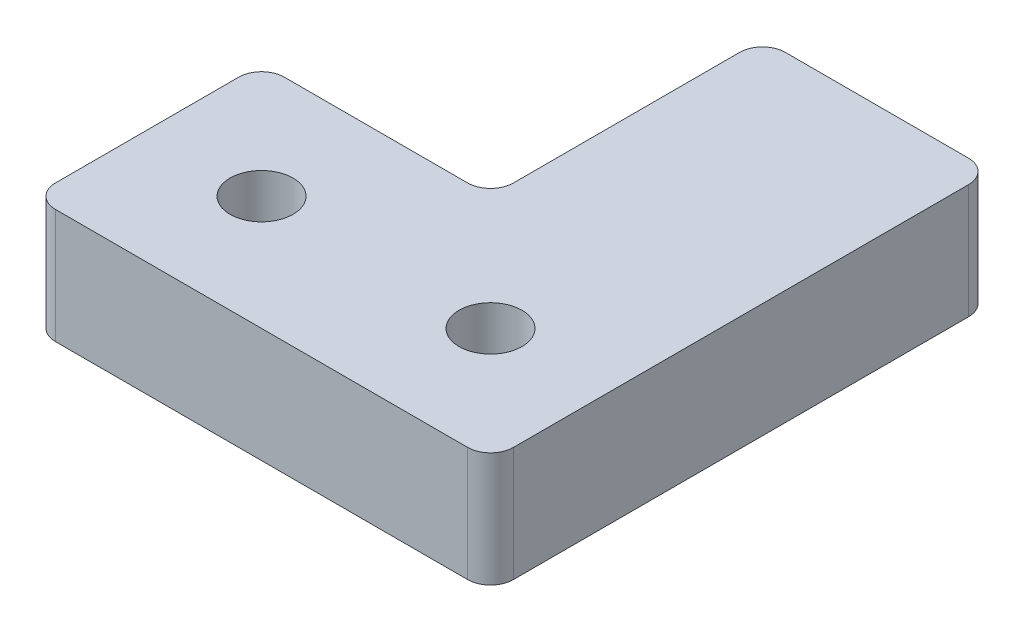
from build123d import *

# Parameters (mm, degrees)
BOSS_EXTRUDE1_DEPTH           = 10
CBORE_FOR_M5_SHCS1_AT_2_COUNT = 2
CBORE_FOR_M5_SHCS1_AT_2_PITCH = 20
FILLET1_R                     = 2


with BuildPart() as part:
    # Sketch1 → Boss-Extrude1 (new body)
    with BuildSketch(Plane(origin=(0, 0, 0), x_dir=(1, 0, 0), z_dir=(0, 1, 0))):
        Polygon((0, 0), (40, 0), (40, 43.75), (20, 43.75), (20, 20), (0, 20), align=None)
    extrude(amount=BOSS_EXTRUDE1_DEPTH)

    # Sketch4 → CBORE for M5 SHCS1 (revolve, cut)
    with BuildSketch(Plane(origin=(10, 0, -10), x_dir=(0, 0, -1), z_dir=(1, 0, 0))):
        Polygon((0, 0), (0, 10), (2.75, 10), (2.75, 5), (5, 5), (5, 0.025), (5.025, 0), align=None)
    cbore_for_m5_shcs1 = revolve(axis=Axis((10, -6.35, -10), (0, 1, 0)), mode=Mode.SUBTRACT)

    # CBORE for M5 SHCS1 at 2: CBORE for M5 SHCS1 ×2
    with Locations(*[(i * CBORE_FOR_M5_SHCS1_AT_2_PITCH, 0, 0) for i in range(1, CBORE_FOR_M5_SHCS1_AT_2_COUNT)]):
        add(cbore_for_m5_shcs1, mode=Mode.SUBTRACT)

    # Fillet1
    fillet1_edges = [part.edges().sort_by_distance(p)[0] for p in [
        (20, 5, -20),
        (20, 5, -43.75),
        (40, 5, -43.75),
        (0, 5, -20),
        (0, 5, 0),
        (40, 5, 0),
    ]]
    fillet(fillet1_edges, radius=FILLET1_R)


solid = part.part
